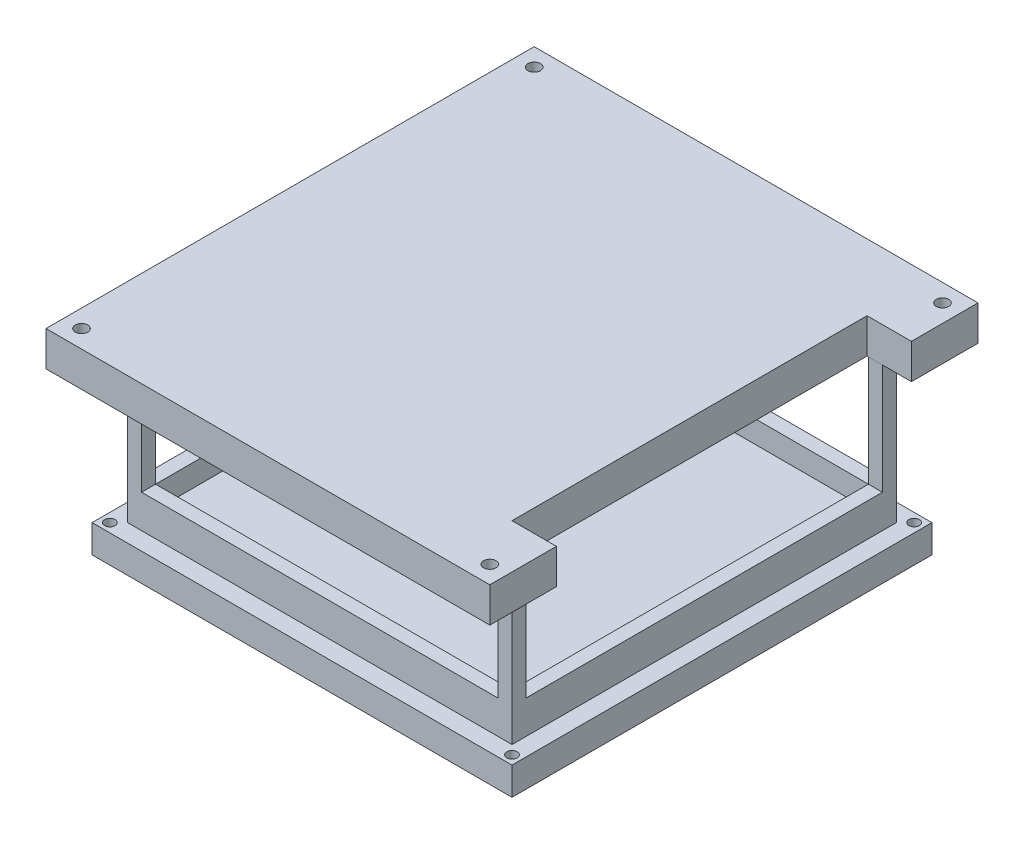
from build123d import *

# Parameters (mm, degrees)
SKETCH1_W           = 110
SKETCH1_H           = 110
BOSS_EXTRUDE1_DEPTH = 9.525
SKETCH3_W           = 120.16
SKETCH3_H           = 120.16
BOSS_EXTRUDE2_DEPTH = 8
SKETCH4_R           = 1.5
CUT_EXTRUDE2_DEPTH  = 86.498177905
SKETCH2_W           = 102
SKETCH2_H           = 102
CUT_EXTRUDE1_DEPTH  = 6.35
SKETCH5_W           = 4
SKETCH5_H           = 4
BOSS_EXTRUDE3_DEPTH = 31.75
SKETCH8_W           = 127
SKETCH8_H           = 139.7
BOSS_EXTRUDE4_DEPTH = 10
SKETCH11_R          = 1.778
CUT_EXTRUDE4_DEPTH  = 10
SKETCH13_W          = 12.7
SKETCH13_H          = 101.6
CUT_EXTRUDE5_DEPTH  = 10


with BuildPart() as part:
    # Sketch1 → Boss-Extrude1 (new body)
    with BuildSketch(Plane(origin=(0, 0, 0), x_dir=(1, 0, 0), z_dir=(0, 1, 0))):
        Rectangle(SKETCH1_W, SKETCH1_H)
    extrude(amount=BOSS_EXTRUDE1_DEPTH)

    # Sketch3 → Boss-Extrude2 (add)
    with BuildSketch(Plane.XZ):
        Rectangle(SKETCH3_W, SKETCH3_H)
    extrude(amount=BOSS_EXTRUDE2_DEPTH)

    # Sketch4 → Cut-Extrude2 (cut, through all)
    with BuildSketch(Plane(origin=(0, 0, 0), x_dir=(1, 0, 0), z_dir=(0, 1, 0))):
        with Locations((-57.54, 57.54)):
            Circle(SKETCH4_R)
        with Locations((57.54, 57.54)):
            Circle(SKETCH4_R)
        with Locations((57.54, -57.54)):
            Circle(SKETCH4_R)
        with Locations((-57.54, -57.54)):
            Circle(SKETCH4_R)
    extrude(amount=-CUT_EXTRUDE2_DEPTH, mode=Mode.SUBTRACT)

    # Sketch2 → Cut-Extrude1 (cut)
    with BuildSketch(Plane(origin=(0, 9.525, 0), x_dir=(1, 0, 0), z_dir=(0, 1, 0))):
        Rectangle(SKETCH2_W, SKETCH2_H)
    extrude(amount=-CUT_EXTRUDE1_DEPTH, mode=Mode.SUBTRACT)

    # Sketch5 → Boss-Extrude3 (add)
    with BuildSketch(Plane(origin=(0, 9.525, 0), x_dir=(1, 0, 0), z_dir=(0, 1, 0))):
        with Locations((-53, 53)):
            Rectangle(SKETCH5_W, SKETCH5_H)
        with Locations((-53, -53)):
            Rectangle(SKETCH5_W, SKETCH5_H)
        with Locations((53, -53)):
            Rectangle(SKETCH5_W, SKETCH5_H)
        with Locations((53, 53)):
            Rectangle(SKETCH5_W, SKETCH5_H)
    extrude(amount=BOSS_EXTRUDE3_DEPTH)

    # Sketch8 → Boss-Extrude4 (add)
    with BuildSketch(Plane(origin=(0, 41.275, 0), x_dir=(1, 0, 0), z_dir=(0, 1, 0))):
        Rectangle(SKETCH8_W, SKETCH8_H)
    extrude(amount=BOSS_EXTRUDE4_DEPTH)

    # Sketch11 → Cut-Extrude4 (cut)
    with BuildSketch(Plane(origin=(0, 41.275, 0), x_dir=(1, 0, 0), z_dir=(0, 1, 0))):
        with Locations((-58.42, 64.77)):
            Circle(SKETCH11_R)
        with Locations((58.42, 64.77)):
            Circle(SKETCH11_R)
        with Locations((-58.42, -64.77)):
            Circle(SKETCH11_R)
        with Locations((58.42, -64.77)):
            Circle(SKETCH11_R)
    extrude(amount=CUT_EXTRUDE4_DEPTH, mode=Mode.SUBTRACT)

    # Sketch13 → Cut-Extrude5 (cut)
    with BuildSketch(Plane(origin=(0, 51.275, 0), x_dir=(1, 0, 0), z_dir=(0, 1, 0))):
        with Locations((57.15, 0)):
            Rectangle(SKETCH13_W, SKETCH13_H)
    extrude(amount=-CUT_EXTRUDE5_DEPTH, mode=Mode.SUBTRACT)


solid = part.part
